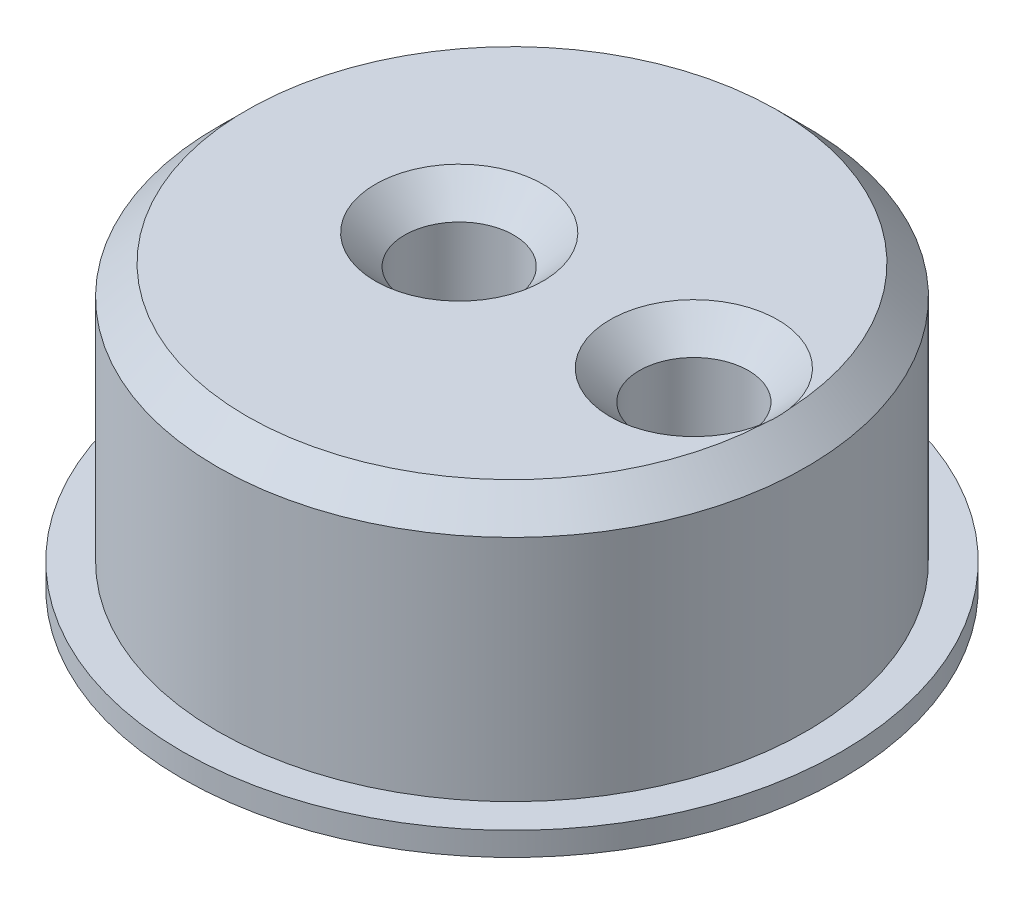
from build123d import *
from build123d.topology import SkipClean

# Parameters (mm, degrees)
SKETCH_1_R      = 5.02
SKETCH_1_R_2    = 0.93
EXTRUDE_1_DEPTH = 4.4
EXTRUDE_START   = 0.4
SKETCH_3_R      = 5.62
SKETCH_3_R_2    = 0.93
EXTRUDE_2_DEPTH = 0.4
CHAMFER_1_SIZE  = 0.5


with BuildPart() as part:
    # 草图1 → 凸台-拉伸1 (new body)
    with BuildSketch(Plane(origin=(0, 0, 0), x_dir=(1, 0, 0), z_dir=(0, 1, 0))):
        with Locations(Location((0, 0, 0), (0, 0, 270))):
            Circle(SKETCH_1_R)
        with Locations(Location((3.1, 0, 0), (0, 0, 270))):
            Circle(SKETCH_1_R_2, mode=Mode.SUBTRACT)
        with Locations(Location((-0.9, 0, 0), (0, 0, 90))):
            Circle(SKETCH_1_R_2, mode=Mode.SUBTRACT)
    extrude(amount=EXTRUDE_1_DEPTH)

    # 草图3 → 凸台-拉伸2 (add)
    with SkipClean():  # the faces are left unmerged after this step: merging them gives an invalid solid
        with BuildSketch(Plane.XZ.offset(EXTRUDE_START)):
            with Locations(Location((0, 0, 0), (0, 0, 270))):
                Circle(SKETCH_3_R)
            with Locations(Location((3.1, 0, 0), (0, 0, 270))):
                Circle(SKETCH_3_R_2, mode=Mode.SUBTRACT)
            with Locations(Location((-0.9, 0, 0), (0, 0, 270))):
                Circle(SKETCH_3_R_2, mode=Mode.SUBTRACT)
        extrude(amount=-EXTRUDE_2_DEPTH)

    # 倒角1
    # the kernel refuses this chamfer: 0.5 mm, written as the material it takes off along each edge
    with BuildSketch(Plane(origin=(3.1, -0.4, 0), x_dir=(0, 0, -1), z_dir=(-1, 0, 0))) as chamfer_1_piece_1:
        Polygon((0.93 + CHAMFER_1_SIZE, 0), (0.93, -CHAMFER_1_SIZE), (0.93, 0), align=None)
    revolve(axis=Axis((3.1, -0.4, 0), (0, -1, 0)), mode=Mode.SUBTRACT)
    with BuildSketch(Plane(origin=(-0.9, -0.4, 0), x_dir=(0, 0, -1), z_dir=(-1, 0, 0))) as chamfer_1_piece_2:
        Polygon((0.93 + CHAMFER_1_SIZE, 0), (0.93, -CHAMFER_1_SIZE), (0.93, 0), align=None)
    revolve(axis=Axis((-0.9, -0.4, 0), (0, -1, 0)), mode=Mode.SUBTRACT)
    with BuildSketch(Plane(origin=(0, 4.4, 0), x_dir=(0, 0, 1), z_dir=(-1, 0, 0))) as chamfer_1_piece_3:
        Polygon((5.02, -CHAMFER_1_SIZE), (5.02 - CHAMFER_1_SIZE, 0), (5.02, 0), align=None)
    revolve(axis=Axis((0, 4.4, 0), (0, 1, 0)), mode=Mode.SUBTRACT)
    with BuildSketch(Plane(origin=(3.1, 4.4, 0), x_dir=(0, 0, 1), z_dir=(-1, 0, 0))) as chamfer_1_piece_4:
        Polygon((0.93 + CHAMFER_1_SIZE, 0), (0.93, -CHAMFER_1_SIZE), (0.93, 0), align=None)
    revolve(axis=Axis((3.1, 4.4, 0), (0, 1, 0)), mode=Mode.SUBTRACT)
    with BuildSketch(Plane(origin=(-0.9, 4.4, 0), x_dir=(0, 0, -1), z_dir=(1, 0, 0))) as chamfer_1_piece_5:
        Polygon((0.93 + CHAMFER_1_SIZE, 0), (0.93, -CHAMFER_1_SIZE), (0.93, 0), align=None)
    revolve(axis=Axis((-0.9, 4.4, 0), (0, 1, 0)), mode=Mode.SUBTRACT)


solid = part.part
